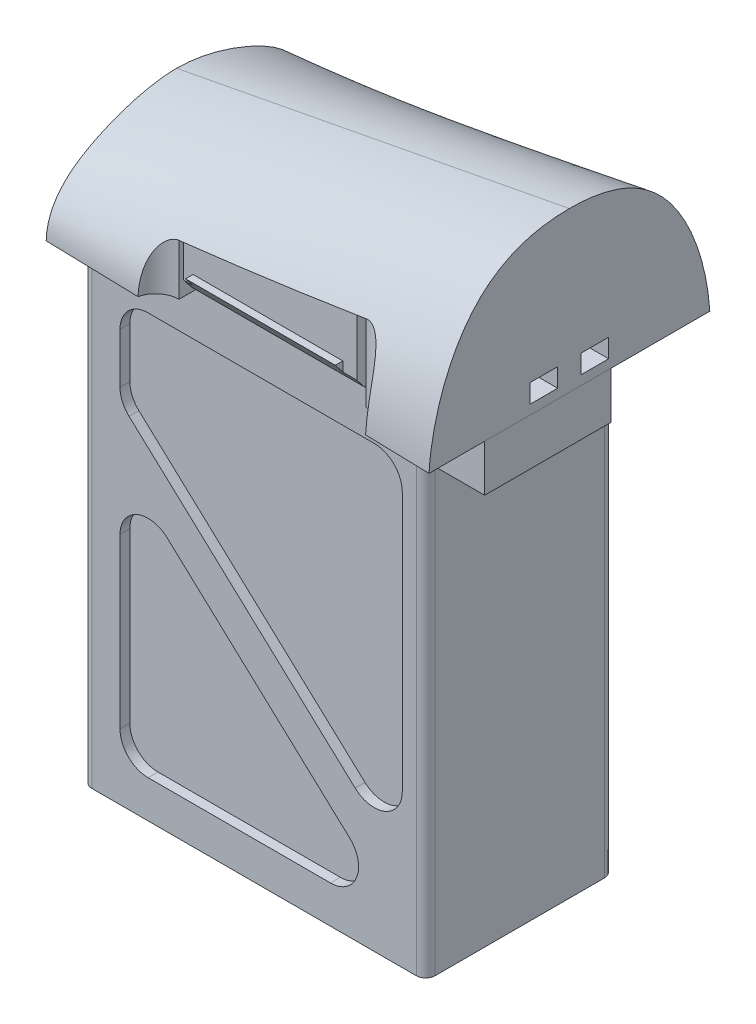
from build123d import *

# Parameters (mm, degrees)
SKETCH_1_W             = 73.3
SKETCH_1_H             = 104.2
EXTRUDE_1_DEPTH        = 20.1
SKETCH_2_W             = 27
SKETCH_2_H             = 10
EXTRUDE_2_DEPTH        = 10.6
CUT_EXTRUDE_1_DEPTH    = 150.103328411
SKETCH_13_W            = 5.892656798
SKETCH_13_H            = 4
CUT_EXTRUDE_4_DEPTH    = 124.904883035
FILLET_5_R             = 2
CUT_EXTRUDE_5_DEPTH    = 2.1
FILLET_6_R             = 6
FILLET_6_OF_MIRROR_2_R = 6
CUT_EXTRUDE_START      = -3.7
CUT_EXTRUDE_6_DEPTH    = 3.7
EXTRUDE_START          = -3
EXTRUDE_5_DEPTH        = 32
CUT_EXTRUDE_7_DEPTH    = 37


# Read off the part's stored shape, not the designer's step: 切除-拉伸6
with BuildPart() as part:
    # 草图1 → 凸台-拉伸1 (new, symmetric)
    with BuildSketch(Plane.XY):
        Rectangle(SKETCH_1_W, SKETCH_1_H)
    extrude(amount=EXTRUDE_1_DEPTH, both=True)

    # 草图2 → 凸台-拉伸2 (add)
    with BuildSketch(Plane(origin=(36.65, 0, 0), x_dir=(0, 0, -1), z_dir=(1, 0, 0))):
        with Locations((-4.6, 47.1)):
            Rectangle(SKETCH_2_W, SKETCH_2_H)
    extrude(amount=EXTRUDE_2_DEPTH)

    # 圆角5
    fillet_5_edges = [part.edges().sort_by_distance(p)[0] for p in [
        (36.65, 0, 20.1),
        (-36.65, 0, 20.1),
        (-36.65, 0, -20.1),
        (36.65, 0, -20.1),
    ]]
    fillet(fillet_5_edges, radius=FILLET_5_R - 0.0001)  # a hair under: the kernel refuses the full size

    # 草图14 → 切除-拉伸5 (cut)
    with BuildSketch(Plane(origin=(0, 0, -20.1), x_dir=(-1, 0, 0), z_dir=(0, 0, -1))):
        Polygon((-31.65, 41.9), (28.65, 41.9), (28.65, 22.5), (-31.65, -33.208507203), align=None)
        Polygon((-31.65, -44.1), (28.65, -44.1), (28.65, 11.608507203), align=None)
    cut_extrude_5 = extrude(amount=-CUT_EXTRUDE_5_DEPTH, mode=Mode.SUBTRACT)

    # 圆角6
    fillet_6_edges = [part.edges().sort_by_distance(p)[0] for p in [
        (31.65, -33.208507203, -19.05),
        (31.65, 41.9, -19.05),
        (-28.65, 41.9, -19.05),
        (-28.65, 22.5, -19.05),
        (31.65, -44.1, -19.05),
        (-28.65, 11.608507203, -19.05),
        (-28.65, -44.1, -19.05),
    ]]
    fillet(fillet_6_edges, radius=FILLET_6_R)

    # 镜向2: 切除-拉伸5 across plane
    add(cut_extrude_5.mirror(Plane.XY), mode=Mode.SUBTRACT)

    # 圆角6 of 镜向2
    fillet_6_of_mirror_2_edges = [part.edges().sort_by_distance(p)[0] for p in [
        (31.65, -33.208507203, 19.05),
        (31.65, 41.9, 19.05),
        (-28.65, 41.9, 19.05),
        (-28.65, 22.5, 19.05),
        (31.65, -44.1, 19.05),
        (-28.65, 11.608507203, 19.05),
        (-28.65, -44.1, 19.05),
    ]]
    fillet(fillet_6_of_mirror_2_edges, radius=FILLET_6_OF_MIRROR_2_R)


with BuildPart() as body_2:
    # 草图8 → 放样11 section 0
    with BuildSketch(Plane(origin=(47.25, 0, 0), x_dir=(0, 0, -1), z_dir=(1, 0, 0))):
        with BuildLine():
            Line((-30, 52.1), (30, 52.1))
            add(Edge.make_bspline(
                [(0, 86.1), (8.566359437, 86.1), (23.54859031, 79.814309679), (29.414977023, 61.202134763), (30, 52.1)],
                knots=[0, 0, 0, 0, 0.419616758, 1, 1, 1, 1], degree=3))
            add(Edge.make_bspline(
                [(0, 86.1), (-8.566359437, 86.1), (-23.54859031, 79.814309679), (-29.414977023, 61.202134763), (-30, 52.1)],
                knots=[0, 0, 0, 0, 0.419616758, 1, 1, 1, 1], degree=3))
        make_face()
    # 草图9 → 放样11 section 1
    with BuildSketch(Plane.ZY.offset(36.65)):
        with BuildLine():
            Line((-27.873983974, 52.1), (27.873983974, 52.1))
            add(Edge.make_bspline(
                [(0, 70.1), (4.734777204, 70.1), (17.075617158, 66.979270336), (27.707744353, 59.568671532), (27.873983974, 52.1)],
                knots=[0, 0, 0, 0, 0.435513689, 1, 1, 1, 1], degree=3))
            add(Edge.make_bspline(
                [(0, 70.1), (-4.734777204, 70.1), (-17.075617158, 66.979270336), (-27.707744353, 59.568671532), (-27.873983974, 52.1)],
                knots=[0, 0, 0, 0, 0.435513689, 1, 1, 1, 1], degree=3))
        make_face()
    loft()

    # 草图10 → 切除-拉伸1 (cut, through all)
    with BuildSketch(Plane.XZ.offset(52.1)):
        with BuildLine():
            Line((-11.65, 34.5), (28.35, 34.5))
            ThreePointArc((28.35, 34.5), (33.35, 29.5), (28.35, 24.5))
            Line((28.35, 24.5), (-11.65, 24.5))
            ThreePointArc((-11.65, 24.5), (-16.65, 29.5), (-11.65, 34.5))
        make_face()
    cut_extrude_1 = extrude(amount=-CUT_EXTRUDE_1_DEPTH, mode=Mode.SUBTRACT)

    # 镜向1: 切除-拉伸1 across plane
    add(cut_extrude_1.mirror(Plane.XY), mode=Mode.SUBTRACT)

    # 草图13 → 切除-拉伸4 (cut, through all)
    with BuildSketch(Plane.ZY.offset(36.65)):
        with Locations((5.446328399, 56.1)):
            Rectangle(SKETCH_13_W, SKETCH_13_H)
        with Locations((-5.446328399, 56.1)):
            Rectangle(SKETCH_13_W, SKETCH_13_H)
    extrude(amount=-CUT_EXTRUDE_4_DEPTH, mode=Mode.SUBTRACT)

    # 切除-拉伸6 outline → 切除-拉伸6 (cut)
    with BuildSketch(Plane(origin=(0, 0, -24.5), x_dir=(-1, 0, 0), z_dir=(0, 0, -1)).offset(CUT_EXTRUDE_START)):
        with BuildLine():
            Line((11.65, 52.1), (11.65, 63.016574647))
            add(Edge.make_bspline(
                [(11.65, 63.016574647), (11.316642702, 63.054787825), (10.983309337, 63.093175333), (10.65000001, 63.131737945)],
                knots=[0, 0, 0, 0, 0.024925497, 0.024925497, 0.024925497, 0.024925497], degree=3))
            Line((10.65000001, 63.131737945), (10.65, 54.1))
            Line((10.65, 54.1), (-26.35, 54.1))
            Line((-26.35, 54.1), (-26.349995612, 68.187634584))
            add(Edge.make_bspline(
                [(-26.349995612, 68.187634584), (-27.016777374, 68.29352852), (-27.683445793, 68.400248086), (-28.35, 68.507799608)],
                knots=[0.949846275, 0.949846275, 0.949846275, 0.949846275, 1, 1, 1, 1], degree=3))
            Line((-28.35, 68.507799608), (-28.35, 52.1))
            Line((-28.35, 52.1), (11.65, 52.1))
        make_face()
    cut_extrude_6 = extrude(amount=CUT_EXTRUDE_6_DEPTH, mode=Mode.SUBTRACT)

    # 草图18 → 凸台-拉伸5 (add)
    with BuildSketch(Plane(origin=(26.35, 0, 0), x_dir=(0, 0, -1), z_dir=(1, 0, 0)).offset(EXTRUDE_START)):
        Polygon((24.5, 58.2), (24.5, 56.15), (26.1, 58.2), align=None)
    extrude_5 = extrude(amount=-EXTRUDE_5_DEPTH)

    # 草图18<3> → 切除-拉伸7 (cut)
    with BuildSketch(Plane(origin=(26.35, 0, 0), x_dir=(0, 0, -1), z_dir=(1, 0, 0))):
        Polygon((22.9, 54.1), (24.5, 54.1), (24.5, 56.15), align=None)
    cut_extrude_7 = extrude(amount=-CUT_EXTRUDE_7_DEPTH, mode=Mode.SUBTRACT)

    # 镜向3: 切除-拉伸6, 凸台-拉伸5, 切除-拉伸7 across plane
    add(cut_extrude_6.mirror(Plane.XY), mode=Mode.SUBTRACT)
    add(extrude_5.mirror(Plane.XY))
    add(cut_extrude_7.mirror(Plane.XY), mode=Mode.SUBTRACT)


solid = Compound([part.part, body_2.part])
